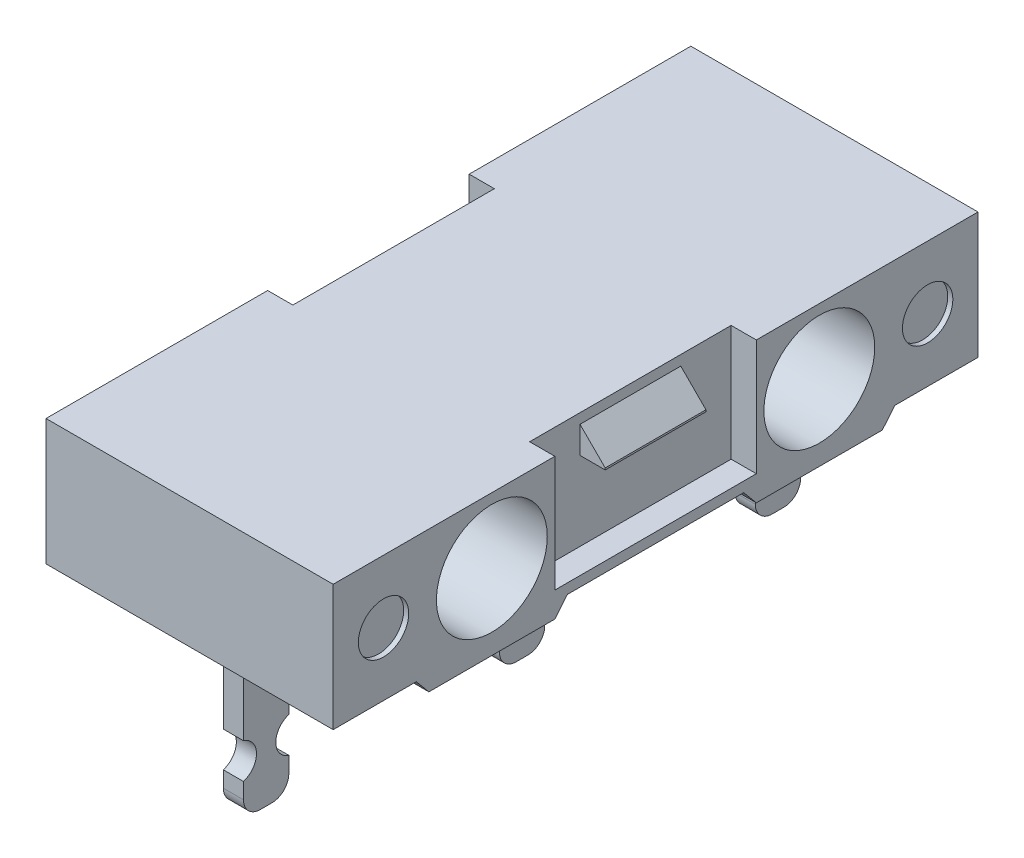
from build123d import *

# Parameters (mm, degrees)
SKETCH_1_W          = 12.8
SKETCH_1_H          = 2.5
BODY_DEPTH          = 5.7
BODY_1_DEPTH        = 5.7
SKETCH_4_W          = 4
SKETCH_4_H          = 2.3
SKETCH_4_W_2        = 2
SKETCH_4_H_2        = 0.535055338
CUT_DEPTH           = 0.5
SKETCH_2_R          = 1.1
HOLES_DEPTH         = 5.7
CHAMFER_2_SIZE      = 0.5
SKETCH_5_W          = 0.4
SKETCH_5_H          = 0.9
LEGS_DEPTH          = 3.3
CUT_EXTRUDE_3_DEPTH = 0.4
FILLET_1_R          = 0.335
SKETCH_7_W          = 1.2
SKETCH_7_H          = 1.2
TEXT1_DEPTH         = 0.1
SKETCH_8_R          = 0.5
CIRCLES1_DEPTH      = 0.1


with BuildPart() as part:
    # Эскиз1 → Body (new body)
    with BuildSketch(Plane(origin=(0, 0, 0), x_dir=(0, 0, -1), z_dir=(1, 0, 0))):
        Rectangle(SKETCH_1_W, SKETCH_1_H)
    extrude(amount=BODY_DEPTH)

    # Эскиз3 → Body_1 (add)
    with BuildSketch(Plane(origin=(5.7, 0, 0), x_dir=(0, 0, -1), z_dir=(1, 0, 0))):
        Polygon((-4.75, -1.25), (-4.5, -1.55), (-2, -1.55), (-1.75, -1.25), align=None)
        Polygon((2, -1.55), (1.75, -1.25), (4.75, -1.25), (4.5, -1.55), align=None)
    extrude(amount=-BODY_1_DEPTH)

    # Эскиз4 → Cut (cut)
    with BuildSketch(Plane(origin=(5.7, 0, 0), x_dir=(0, 0, -1), z_dir=(1, 0, 0))):
        with Locations((0, 0.1)):
            Rectangle(SKETCH_4_W, SKETCH_4_H)
        with Locations((0, 0.782472331)):
            Rectangle(SKETCH_4_W_2, SKETCH_4_H_2, mode=Mode.SUBTRACT)
    cut = extrude(amount=-CUT_DEPTH, mode=Mode.SUBTRACT)

    # Эскиз2 → Holes (cut)
    with BuildSketch(Plane(origin=(5.7, 0, 0), x_dir=(0, 0, -1), z_dir=(1, 0, 0))):
        with Locations((-3.25, -0.05)):
            Circle(SKETCH_2_R)
        with Locations((3.25, -0.05)):
            Circle(SKETCH_2_R)
    extrude(amount=-HOLES_DEPTH, mode=Mode.SUBTRACT)

    # Mirror 2: Cut across plane
    add(cut.mirror(Plane(origin=(2.85, 0, 0), x_dir=(0, 0, 1), z_dir=(1, 0, 0))), mode=Mode.SUBTRACT)

    # Chamfer 2
    chamfer_2_edges = [part.edges().sort_by_distance(p)[0] for p in [
        (5.7, 1.05, 0),
        (0, 1.05, 0),
    ]]
    chamfer(chamfer_2_edges, length=CHAMFER_2_SIZE - 0.0001)  # a hair under: the kernel refuses the full size

    # Эскиз5 → Legs (add)
    with BuildSketch(Plane.XZ.offset(1.25)):
        with Locations((2.85, 5.08)):
            Rectangle(SKETCH_5_W, SKETCH_5_H)
        with Locations((2.85, -5.08)):
            Rectangle(SKETCH_5_W, SKETCH_5_H)
        with Locations((2.85, 0)):
            Rectangle(SKETCH_5_W, SKETCH_5_H)
    extrude(amount=LEGS_DEPTH)

    # Эскиз6 → Вырез-Вытянуть3 (cut)
    with BuildSketch(Plane(origin=(3.05, 0, 0), x_dir=(0, 0, -1), z_dir=(1, 0, 0))):
        with BuildLine():
            Line((-5.53, -3.2), (-5.53, -3.9))
            ThreePointArc((-5.53, -3.9), (-5.271477555, -3.55), (-5.53, -3.2))
        make_face()
        with BuildLine():
            Line((-4.63, -3.2), (-4.63, -3.9))
            ThreePointArc((-4.63, -3.9), (-4.888522445, -3.55), (-4.63, -3.2))
        make_face()
        with BuildLine():
            Line((0.45, -3.2), (0.45, -3.9))
            ThreePointArc((0.45, -3.9), (0.191477555, -3.55), (0.45, -3.2))
        make_face()
        with BuildLine():
            Line((-0.45, -3.2), (-0.45, -3.9))
            ThreePointArc((-0.45, -3.9), (-0.191477555, -3.55), (-0.45, -3.2))
        make_face()
        with BuildLine():
            Line((4.63, -3.2), (4.63, -3.9))
            ThreePointArc((4.63, -3.9), (4.888522445, -3.55), (4.63, -3.2))
        make_face()
        with BuildLine():
            Line((5.53, -3.2), (5.53, -3.9))
            ThreePointArc((5.53, -3.9), (5.271477555, -3.55), (5.53, -3.2))
        make_face()
    extrude(amount=-CUT_EXTRUDE_3_DEPTH, mode=Mode.SUBTRACT)

    # Скругление1
    fillet_1_edges = [part.edges().sort_by_distance(p)[0] for p in [
        (2.85, -4.55, 5.53),
        (2.85, -4.55, 4.63),
        (2.85, -4.55, -5.53),
        (2.85, -4.55, -4.63),
        (2.85, -4.55, 0.45),
        (2.85, -4.55, -0.45),
    ]]
    fillet(fillet_1_edges, radius=FILLET_1_R)

    # Эскиз7 → Text1 (cut)
    # profile 1 of 3: a face of its own
    with BuildSketch(Plane.ZY):
        with Locations((-5.434660372, 0)):
            Rectangle(SKETCH_7_W, SKETCH_7_H)
    # profile 2 of 3: a face of its own
    with BuildSketch(Plane.ZY):
        with BuildLine():
            Line((5.383453526, 0.653645833), (5.395873397, 0.529447115))
            add(Edge.make_bspline(
                [(5.395873397, 0.529447115), (5.391934104, 0.529656157), (5.384857943, 0.530031659), (5.37557592, 0.5304133), (5.368898288, 0.530676684), (5.365358009, 0.530656611), (5.364022436, 0.530649038)],
                knots=[0, 0, 0, 0, 1.484943698, 2.667407844, 3.497278719, 4, 4, 4, 4], degree=3))
            add(Edge.make_bspline(
                [(5.364022436, 0.530649038), (5.356592512, 0.530369341), (5.341550207, 0.529803078), (5.318924406, 0.525414568), (5.296256921, 0.518101864), (5.273914423, 0.508248318), (5.252906863, 0.49600394), (5.233957301, 0.481718891), (5.217783475, 0.465192562), (5.204646829, 0.44669337), (5.194157991, 0.427099857), (5.186766913, 0.406646813), (5.181816943, 0.385652453), (5.181359364, 0.37135524), (5.181129808, 0.364182692)],
                knots=[0, 0, 0, 0, 0.976208312, 1.976389376, 3.017333744, 4.101917133, 5.179767123, 6.206740949, 7.212261063, 8.206067176, 9.179825975, 10.123939742, 11.058828423, 12, 12, 12, 12], degree=3))
            add(Edge.make_bspline(
                [(5.181129808, 0.364182692), (5.181664857, 0.354585663), (5.182750305, 0.335116271), (5.190770258, 0.305993826), (5.203006424, 0.276633226), (5.220261911, 0.247586847), (5.242024732, 0.219667987), (5.268693991, 0.194313641), (5.299989652, 0.172043338), (5.334748093, 0.152737906), (5.371685888, 0.137201916), (5.409151681, 0.125596002), (5.446549634, 0.118469296), (5.471498479, 0.117611124), (5.483814103, 0.1171875)],
                knots=[0, 0, 0, 0, 0.805051923, 1.633200182, 2.520339381, 3.470358503, 4.460715651, 5.483826621, 6.548153277, 7.677576324, 8.815732689, 9.906431599, 10.966541267, 12, 12, 12, 12], degree=3))
            add(Edge.make_bspline(
                [(5.483814103, 0.1171875), (5.490566595, 0.117329126), (5.50378218, 0.117606309), (5.523066665, 0.120133039), (5.541396363, 0.123850563), (5.558679578, 0.129222734), (5.574792139, 0.136346728), (5.589970405, 0.14474439), (5.603996984, 0.15485671), (5.617068717, 0.16627064), (5.628790321, 0.178941318), (5.638899704, 0.192777547), (5.647586235, 0.207426636), (5.654634715, 0.223155323), (5.659975955, 0.23991121), (5.66407579, 0.257508738), (5.666203586, 0.276122964), (5.666536427, 0.288790753), (5.666706731, 0.295272436)],
                knots=[0, 0, 0, 0, 1.126534762, 2.204788134, 3.24086036, 4.245463625, 5.218665249, 6.176687804, 7.135423198, 8.098940344, 9.069073939, 10.009760319, 10.954005176, 11.906827407, 12.879582212, 13.885359405, 14.91800917, 16, 16, 16, 16], degree=3))
            add(Edge.make_bspline(
                [(5.666706731, 0.295272436), (5.666428669, 0.304113824), (5.665876381, 0.321674677), (5.660515196, 0.347463412), (5.652628308, 0.372592549), (5.640900318, 0.396715008), (5.626464773, 0.4202981), (5.608642089, 0.44305295), (5.587538687, 0.464901798), (5.571678538, 0.478301642), (5.563541667, 0.485176282)],
                knots=[0, 0, 0, 0, 0.946950825, 1.880843019, 2.813828828, 3.76512863, 4.748862953, 5.774448625, 6.858205792, 8, 8, 8, 8], degree=3))
            Line((5.563541667, 0.485176282), (5.570753205, 0.591947115))
            Line((5.570753205, 0.591947115), (6.078165064, 0.443309295))
            Line((6.078165064, 0.443309295), (6.078966346, -0.040865385))
            Line((6.078966346, -0.040865385), (5.966786859, -0.017027244))
            Line((5.966786859, -0.017027244), (5.965985577, 0.359375))
            Line((5.965985577, 0.359375), (5.713782051, 0.433293269))
            add(Edge.make_bspline(
                [(5.713782051, 0.433293269), (5.718625135, 0.426348554), (5.728193357, 0.412628252), (5.740572646, 0.391189009), (5.751079491, 0.369422409), (5.759669755, 0.347374405), (5.766607276, 0.325048313), (5.77138112, 0.302381535), (5.774261764, 0.27938805), (5.77467305, 0.263963828), (5.774879808, 0.256209936)],
                knots=[0, 0, 0, 0, 1.066300652, 2.106633084, 3.115012457, 4.10857985, 5.08519264, 6.057010962, 7.02324229, 8, 8, 8, 8], degree=3))
            add(Edge.make_bspline(
                [(5.774879808, 0.256209936), (5.774643194, 0.246917709), (5.774180238, 0.228736605), (5.770718834, 0.202101578), (5.764992672, 0.176768081), (5.756600066, 0.152746456), (5.746297607, 0.129813425), (5.733300034, 0.108240598), (5.718056221, 0.087907952), (5.700350793, 0.069159642), (5.680904732, 0.051927519), (5.659428221, 0.037010013), (5.63630376, 0.024282689), (5.611311457, 0.014147662), (5.584694397, 0.0060753), (5.55632311, 0.000356974), (5.526180624, -0.003376806), (5.505460317, -0.003792948), (5.494831731, -0.00400641)],
                knots=[0, 0, 0, 0, 1.035645339, 2.026336052, 2.988770593, 3.925678782, 4.858378523, 5.786462753, 6.727354475, 7.685837208, 8.656384027, 9.618674628, 10.594743564, 11.59278975, 12.6194883, 13.69102701, 14.815600676, 16, 16, 16, 16], degree=3))
            add(Edge.make_bspline(
                [(5.494831731, -0.00400641), (5.48541222, -0.003839968), (5.466748091, -0.003510173), (5.438992037, -0.001250391), (5.411724341, 0.002419329), (5.385124355, 0.008253648), (5.358927513, 0.014856499), (5.333423986, 0.023622638), (5.308428777, 0.033829066), (5.284045962, 0.045391104), (5.260605635, 0.058306054), (5.238655916, 0.072827728), (5.217865429, 0.088132274), (5.198872481, 0.105046306), (5.180630617, 0.12247773), (5.164337998, 0.14165509), (5.149160078, 0.161713486), (5.135672663, 0.182969272), (5.123342765, 0.204876749), (5.113131351, 0.227592065), (5.103837213, 0.250460606), (5.096827665, 0.273997614), (5.090814872, 0.297811909), (5.086991157, 0.322226246), (5.08416491, 0.346955971), (5.083904463, 0.363640225), (5.083774038, 0.371995192)],
                knots=[0, 0, 0, 0, 1.090766094, 2.161279824, 3.223156619, 4.274165885, 5.313244969, 6.350077268, 7.394036436, 8.438625479, 9.473610619, 10.490233684, 11.484675376, 12.460175899, 13.433528618, 14.403958858, 15.370561199, 16.344405263, 17.317051241, 18.278940538, 19.226676265, 20.173275619, 21.120411763, 22.068778221, 23.032902885, 24, 24, 24, 24], degree=3))
            add(Edge.make_bspline(
                [(5.083774038, 0.371995192), (5.084201812, 0.385853074), (5.085036656, 0.412898119), (5.092551831, 0.452128245), (5.104242576, 0.48904479), (5.121211162, 0.523070606), (5.142114199, 0.553993676), (5.167081297, 0.58095185), (5.195570405, 0.60389094), (5.227495633, 0.622044252), (5.2610252, 0.636217807), (5.29501516, 0.646785341), (5.329116118, 0.653309338), (5.351909027, 0.654069732), (5.363221154, 0.654447115)],
                knots=[0, 0, 0, 0, 1.121214157, 2.188161669, 3.222731722, 4.248089389, 5.255974095, 6.235567275, 7.2126499, 8.20598187, 9.199313841, 10.155448176, 11.084548444, 12, 12, 12, 12], degree=3))
            add(Edge.make_bspline(
                [(5.363221154, 0.654447115), (5.366026228, 0.654396069), (5.372775736, 0.654273242), (5.37951505, 0.653877251), (5.383453526, 0.653645833)],
                knots=[0, 0, 0, 0, 0.831193636, 2, 2, 2, 2], degree=3))
        make_face()
    # profile 3 of 3: a face of its own
    with BuildSketch(Plane.ZY):
        with BuildLine():
            Line((5.327363782, -0.142948718), (5.338982372, -0.257932692))
            add(Edge.make_bspline(
                [(5.338982372, -0.257932692), (5.332286672, -0.258900487), (5.319351843, -0.260770083), (5.300875611, -0.265118193), (5.283827177, -0.269907673), (5.268103863, -0.275143754), (5.254106201, -0.281635118), (5.241511422, -0.288637565), (5.230399484, -0.296467488), (5.217800321, -0.307799091), (5.204910455, -0.323459259), (5.193923355, -0.344349526), (5.186902838, -0.366863052), (5.186130854, -0.382546887), (5.185737179, -0.390544872)],
                knots=[0, 0, 0, 0, 1.087183049, 2.100232459, 3.048408125, 3.934508379, 4.760776869, 5.525096144, 6.248912482, 6.940734901, 8.245193776, 9.484178007, 10.71705458, 12, 12, 12, 12], degree=3))
            add(Edge.make_bspline(
                [(5.185737179, -0.390544872), (5.185943113, -0.396365199), (5.186352621, -0.407939174), (5.18925136, -0.425151168), (5.19404114, -0.442035977), (5.20100646, -0.458546897), (5.209619501, -0.474792996), (5.220102666, -0.490724266), (5.232626821, -0.506180876), (5.242019472, -0.515946728), (5.246834936, -0.520953526)],
                knots=[0, 0, 0, 0, 0.943920653, 1.877027567, 2.823306939, 3.784837961, 4.778178569, 5.80262762, 6.873441868, 8, 8, 8, 8], degree=3))
            add(Edge.make_bspline(
                [(5.246834936, -0.520953526), (5.254583492, -0.528252061), (5.270280794, -0.543037694), (5.296691205, -0.562711802), (5.325002418, -0.581513996), (5.356159042, -0.598176044), (5.389363052, -0.613926973), (5.425173398, -0.627820996), (5.4632643, -0.640534198), (5.489714986, -0.64756528), (5.503245192, -0.651161859)],
                knots=[0, 0, 0, 0, 0.877426452, 1.777521924, 2.712537947, 3.678817246, 4.689122955, 5.742709965, 6.845338089, 8, 8, 8, 8], degree=3))
            add(Edge.make_bspline(
                [(5.503245192, -0.651161859), (5.496060361, -0.641286778), (5.48230297, -0.622378143), (5.464282687, -0.594128783), (5.449358603, -0.567683955), (5.437321285, -0.542695557), (5.428628765, -0.518218435), (5.422274049, -0.493844651), (5.418672917, -0.469109926), (5.418029764, -0.452521314), (5.417708333, -0.444230769)],
                knots=[0, 0, 0, 0, 1.285088245, 2.460664794, 3.52416368, 4.479866755, 5.375711226, 6.253539237, 7.127165539, 8, 8, 8, 8], degree=3))
            add(Edge.make_bspline(
                [(5.417708333, -0.444230769), (5.417912168, -0.436743796), (5.418314004, -0.421984079), (5.421175027, -0.40011142), (5.426018589, -0.378880408), (5.432602794, -0.358215448), (5.441121319, -0.338166214), (5.451562205, -0.318715049), (5.463999437, -0.299827604), (5.47356408, -0.287972098), (5.478405449, -0.281971154)],
                knots=[0, 0, 0, 0, 1.015179347, 2.001310674, 2.985444433, 3.964817641, 4.93860746, 5.935201463, 6.954853608, 8, 8, 8, 8], degree=3))
            add(Edge.make_bspline(
                [(5.478405449, -0.281971154), (5.485163111, -0.27437155), (5.498576017, -0.259287519), (5.521902904, -0.240075348), (5.547173898, -0.223677428), (5.574587894, -0.210177198), (5.60425246, -0.19975566), (5.63609508, -0.192397015), (5.670055645, -0.187980487), (5.693402768, -0.187344953), (5.70536859, -0.187019231)],
                knots=[0, 0, 0, 0, 0.957956614, 1.901394733, 2.839457333, 3.794262083, 4.776262319, 5.79824253, 6.871559528, 8, 8, 8, 8], degree=3))
            add(Edge.make_bspline(
                [(5.70536859, -0.187019231), (5.719140205, -0.187300007), (5.746243661, -0.187852592), (5.786066146, -0.193027047), (5.824414894, -0.201334993), (5.861144265, -0.213556277), (5.896652477, -0.228648493), (5.930316005, -0.247796089), (5.962933901, -0.269673353), (5.982788286, -0.287020782), (5.992828526, -0.295793269)],
                knots=[0, 0, 0, 0, 1.049410971, 2.065310681, 3.055833263, 4.036166432, 5.012035661, 5.991985493, 6.984559511, 8, 8, 8, 8], degree=3))
            add(Edge.make_bspline(
                [(5.992828526, -0.295793269), (6.000997203, -0.303655698), (6.017097691, -0.319152571), (6.038227701, -0.34466947), (6.05585747, -0.371729923), (6.070788077, -0.399896737), (6.08189275, -0.42964501), (6.089936853, -0.460657434), (6.09516307, -0.49293247), (6.095714377, -0.514990468), (6.09599359, -0.526161859)],
                knots=[0, 0, 0, 0, 1.044989142, 2.059676947, 3.04682455, 4.019052188, 4.993441915, 5.967228298, 6.970491951, 8, 8, 8, 8], degree=3))
            add(Edge.make_bspline(
                [(6.09599359, -0.526161859), (6.095732001, -0.536192624), (6.095216906, -0.555944202), (6.090916393, -0.584887744), (6.083876804, -0.612543985), (6.074105837, -0.638963091), (6.061083707, -0.663934659), (6.045440166, -0.687690802), (6.026784041, -0.710005026), (6.005668412, -0.731039658), (5.981778582, -0.750078725), (5.955416018, -0.766800056), (5.926621826, -0.780784576), (5.895503097, -0.79230715), (5.861978024, -0.800946038), (5.826231107, -0.807377118), (5.788115554, -0.811177935), (5.761934376, -0.811733056), (5.7484375, -0.812019231)],
                knots=[0, 0, 0, 0, 0.950507663, 1.8716446, 2.766683318, 3.651999916, 4.535277603, 5.430629625, 6.343201318, 7.287619445, 8.251459332, 9.233093167, 10.240888621, 11.280311307, 12.373467464, 13.518239399, 14.720607041, 16, 16, 16, 16], degree=3))
            add(Edge.make_bspline(
                [(5.7484375, -0.812019231), (5.735012965, -0.811859635), (5.708142654, -0.811540192), (5.667898992, -0.809123388), (5.62774658, -0.804852602), (5.58771795, -0.799051424), (5.547794972, -0.791685989), (5.508041819, -0.782401831), (5.468407793, -0.771441974), (5.44224849, -0.76284568), (5.429126603, -0.758533654)],
                knots=[0, 0, 0, 0, 0.990589153, 1.982745655, 2.973628875, 3.969400426, 4.966743354, 5.968337292, 6.980888344, 8, 8, 8, 8], degree=3))
            add(Edge.make_bspline(
                [(5.429126603, -0.758533654), (5.414105354, -0.753157832), (5.384832936, -0.742681785), (5.342962707, -0.72453404), (5.304194853, -0.70495769), (5.268253929, -0.684168136), (5.235628334, -0.661644875), (5.205742523, -0.638075647), (5.179091685, -0.612741043), (5.16342208, -0.594472358), (5.155689103, -0.585456731)],
                knots=[0, 0, 0, 0, 1.167875377, 2.275878566, 3.338470551, 4.346344121, 5.313223182, 6.238609074, 7.130750505, 8, 8, 8, 8], degree=3))
            add(Edge.make_bspline(
                [(5.155689103, -0.585456731), (5.149952068, -0.578003011), (5.138595977, -0.563248855), (5.123987281, -0.53977024), (5.111787166, -0.515561919), (5.101372751, -0.490884155), (5.093603425, -0.465283623), (5.0880172, -0.439013616), (5.084494894, -0.412073825), (5.084015531, -0.393894126), (5.083774038, -0.384735577)],
                knots=[0, 0, 0, 0, 1.037694619, 2.054049527, 3.046146323, 4.027481427, 5.006600074, 5.99386725, 6.989352664, 8, 8, 8, 8], degree=3))
            add(Edge.make_bspline(
                [(5.083774038, -0.384735577), (5.083984778, -0.376382648), (5.084399038, -0.359962971), (5.087107341, -0.335922225), (5.092195422, -0.313062626), (5.09924345, -0.291432744), (5.107969665, -0.270762259), (5.119222256, -0.251541248), (5.131918207, -0.233118283), (5.147091863, -0.216349016), (5.163923154, -0.200925665), (5.182332631, -0.18698092), (5.202618338, -0.175229234), (5.224292723, -0.164810767), (5.247842797, -0.156843999), (5.272811959, -0.150034625), (5.299534325, -0.145562606), (5.317936113, -0.143834214), (5.327363782, -0.142948718)],
                knots=[0, 0, 0, 0, 1.045593035, 2.055362976, 3.022661796, 3.971550164, 4.900009934, 5.824737832, 6.754588498, 7.695789242, 8.648204815, 9.609381774, 10.579817028, 11.578071809, 12.614269081, 13.686742108, 14.814863565, 16, 16, 16, 16], degree=3))
        make_face()
        with BuildLine():
            add(Edge.make_bspline(
                [(5.719791667, -0.305208333), (5.712171573, -0.305345553), (5.697358875, -0.305612293), (5.675746881, -0.308165032), (5.655280224, -0.311840701), (5.635957986, -0.317263818), (5.617830027, -0.324280179), (5.600898821, -0.332919887), (5.585230989, -0.343190071), (5.570881693, -0.354809295), (5.557834733, -0.367323882), (5.546652234, -0.380763577), (5.537121992, -0.394715836), (5.529229222, -0.409168833), (5.52315631, -0.424296608), (5.519017135, -0.440051636), (5.516252798, -0.456352947), (5.515995585, -0.467456402), (5.515865385, -0.473076923)],
                knots=[0, 0, 0, 0, 1.239303269, 2.409081367, 3.536311487, 4.619759211, 5.668890859, 6.694123748, 7.706613134, 8.71108511, 9.69453797, 10.643230523, 11.550261161, 12.439882023, 13.31748043, 14.195078836, 15.086356658, 16, 16, 16, 16], degree=3))
            add(Edge.make_bspline(
                [(5.515865385, -0.473076923), (5.51631516, -0.48152909), (5.51722723, -0.498668704), (5.524016777, -0.524236464), (5.534967212, -0.549663409), (5.550371578, -0.574656111), (5.569670828, -0.599039494), (5.593967969, -0.621190695), (5.622005002, -0.642011549), (5.653806751, -0.660411231), (5.687865239, -0.675988031), (5.723204381, -0.687008941), (5.758914277, -0.693962639), (5.782928531, -0.694809687), (5.794911859, -0.695232372)],
                knots=[0, 0, 0, 0, 0.778453341, 1.578576179, 2.422299039, 3.322688386, 4.277177225, 5.278764285, 6.343560927, 7.49101274, 8.659013068, 9.788044022, 10.89621411, 12, 12, 12, 12], degree=3))
            add(Edge.make_bspline(
                [(5.794911859, -0.695232372), (5.804209787, -0.694898602), (5.822576178, -0.694239301), (5.849555341, -0.689777971), (5.875485149, -0.682264525), (5.900121396, -0.671970422), (5.922819018, -0.659086235), (5.942952011, -0.643994919), (5.960029107, -0.626597666), (5.973737764, -0.607109788), (5.984487898, -0.586652557), (5.992201715, -0.565776172), (5.997044312, -0.544812135), (5.997708326, -0.530726932), (5.998036859, -0.523758013)],
                knots=[0, 0, 0, 0, 1.133245801, 2.23852418, 3.323018027, 4.417454176, 5.485575042, 6.496497582, 7.47498488, 8.4438786, 9.390464112, 10.284055129, 11.151003962, 12, 12, 12, 12], degree=3))
            add(Edge.make_bspline(
                [(5.998036859, -0.523758013), (5.997749186, -0.516995003), (5.997171743, -0.503419678), (5.993005131, -0.483197859), (5.986137867, -0.463203297), (5.976363803, -0.443626706), (5.964406785, -0.424296018), (5.949554492, -0.40580798), (5.932288404, -0.387930746), (5.912559789, -0.371144461), (5.891011298, -0.355410616), (5.867548849, -0.341866524), (5.842561018, -0.330318658), (5.816416529, -0.321411106), (5.790416594, -0.314355383), (5.765499703, -0.308996213), (5.742107622, -0.305875368), (5.727011248, -0.30542413), (5.719791667, -0.305208333)],
                knots=[0, 0, 0, 0, 0.836576501, 1.679252062, 2.544199187, 3.445901413, 4.381350118, 5.351799967, 6.374458355, 7.452660133, 8.553485525, 9.671695795, 10.799391352, 11.954455246, 13.085023147, 14.131930631, 15.106627853, 16, 16, 16, 16], degree=3))
        make_face(mode=Mode.SUBTRACT)
    extrude(amount=-TEXT1_DEPTH, mode=Mode.SUBTRACT)

    # Эскиз8 → Circles1 (cut)
    with BuildSketch(Plane(origin=(5.7, 0, 0), x_dir=(0, 0, -1), z_dir=(1, 0, 0))):
        with Locations((-5.4, 0)):
            Circle(SKETCH_8_R)
        with Locations(Location((5.4, 0, 0), (0, 0, 180))):
            Circle(SKETCH_8_R)
    extrude(amount=-CIRCLES1_DEPTH, mode=Mode.SUBTRACT)


solid = part.part
